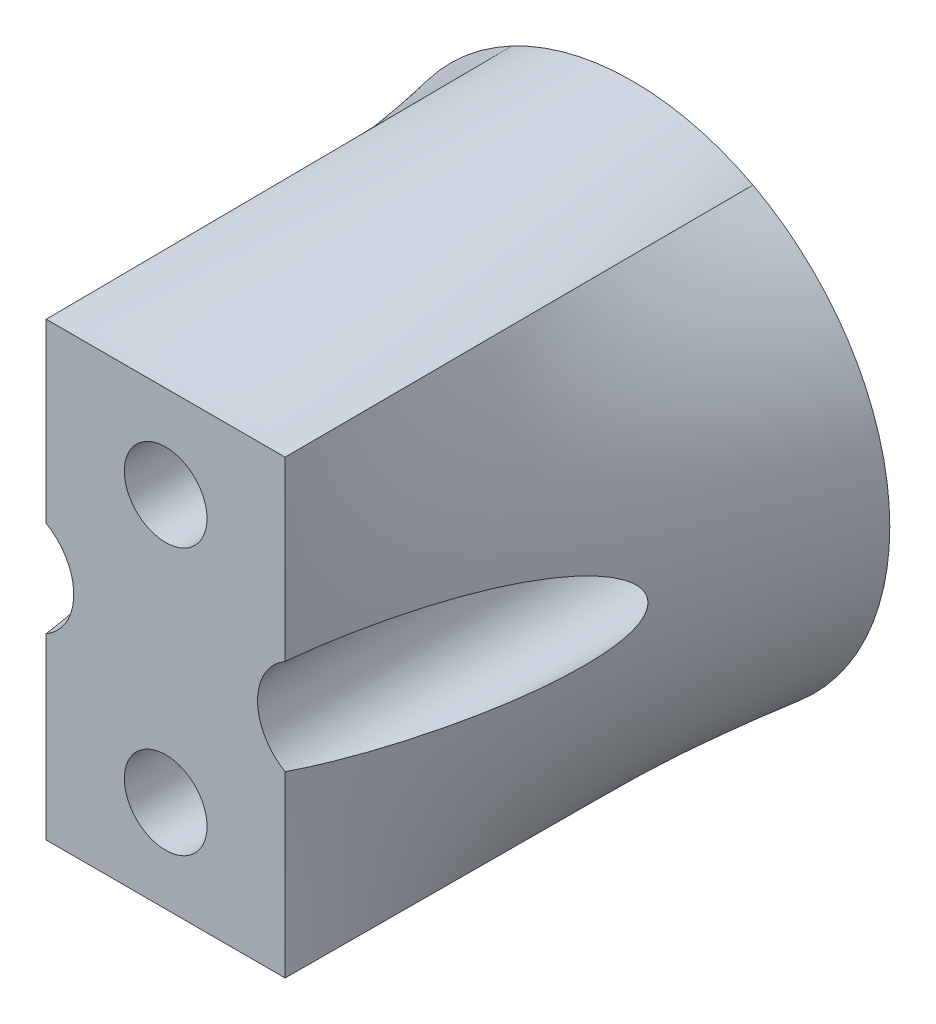
from build123d import *

# Parameters (mm, degrees)
CUT_EXTRUDE1_DEPTH      = 0.254
CUT_EXTRUDE1_DEPTH_BACK = 29.404968727
CUT_EXTRUDE1_START      = -3.8
SKETCH5_R               = 2.999999969
SKETCH5_R_2             = 3
SKETCH6_R               = 1.75
CUT_EXTRUDE2_DEPTH      = 33.204968727
SKETCH7_R               = 2.25
SKETCH7_R_2             = 2.249999945
CUT_EXTRUDE3_DEPTH      = 33.204968727
SKETCH8_R               = 3.8
CUT_EXTRUDE4_DEPTH      = 19.05
SKETCH9_R               = 4.5
CUT_EXTRUDE5_DEPTH      = 3.5


with BuildPart() as part:
    # Loft1: read off the stored shape, not the designer's step
    # Loft1: loft between two sections, ruled curve by curve
    loft1_from = [
        Edge.make_bspline([(6.55325358, -12.371534566, 0), (7.464294458, -11.888952404, 0), (8.384566214, -11.272101526, 0), (10.134710604, -9.728764793, 0), (10.963640628, -8.800972824, 0), (12.385245025, -6.653137916, 0), (12.975801321, -5.432751611, 0), (13.784177023, -2.807609973, 0), (14, -1.404493643, 0), (14, 1.404493643, 0), (13.784177023, 2.807609973, 0), (12.975801321, 5.432751611, 0), (12.385245025, 6.653137916, 0), (10.963640628, 8.800972824, 0), (10.134710604, 9.728764793, 0), (8.384566214, 11.272101526, 0), (7.464294458, 11.888952404, 0), (6.55325358, 12.371534566, 0)], [0, 0, 0, 0, 0.125, 0.125, 0.25, 0.25, 0.375, 0.375, 0.5, 0.5, 0.625, 0.625, 0.75, 0.75, 0.875, 0.875, 1, 1, 1, 1], 3),
        Edge.make_bspline([(6.55325358, 12.371534566, 0), (5.588089256, 12.882786143, 0), (4.533369794, 13.294840206, 0), (2.318771517, 13.853790689, 0), (1.159653791, 14, 0), (-1.159653791, 14, 0), (-2.318771517, 13.853790689, 0), (-4.533369794, 13.294840206, 0), (-5.588089256, 12.882786143, 0), (-6.55325358, 12.371534566, 0)], [0, 0, 0, 0, 0.25, 0.25, 0.5, 0.5, 0.75, 0.75, 1, 1, 1, 1], 3),
        Edge.make_bspline([(-6.55325358, -12.371534566, 0), (-5.588089256, -12.882786143, 0), (-4.533369794, -13.294840206, 0), (-2.318771517, -13.853790689, 0), (-1.159653791, -14, 0), (1.159653791, -14, 0), (2.318771517, -13.853790689, 0), (4.533369794, -13.294840206, 0), (5.588089256, -12.882786143, 0), (6.55325358, -12.371534566, 0)], [0, 0, 0, 0, 0.25, 0.25, 0.5, 0.5, 0.75, 0.75, 1, 1, 1, 1], 3),
        Edge.make_bspline([(-6.55325358, 12.371534566, 0), (-7.464294458, 11.888952404, 0), (-8.384566214, 11.272101526, 0), (-10.134710604, 9.728764793, 0), (-10.963640628, 8.800972824, 0), (-12.385245025, 6.653137916, 0), (-12.975801321, 5.432751611, 0), (-13.784177023, 2.807609973, 0), (-14, 1.404493643, 0), (-14, -1.404493643, 0), (-13.784177023, -2.807609973, 0), (-12.975801321, -5.432751611, 0), (-12.385245025, -6.653137916, 0), (-10.963640628, -8.800972824, 0), (-10.134710604, -9.728764793, 0), (-8.384566214, -11.272101526, 0), (-7.464294458, -11.888952404, 0), (-6.55325358, -12.371534566, 0)], [0, 0, 0, 0, 0.125, 0.125, 0.25, 0.25, 0.375, 0.375, 0.5, 0.5, 0.625, 0.625, 0.75, 0.75, 0.875, 0.875, 1, 1, 1, 1], 3),
    ]
    loft1_to = [
        Edge.make_bspline([(6.5, -12.319, 25.4), (6.5, -11.296416667, 25.4), (6.5, -10.273833333, 25.4), (6.5, -8.228666667, 25.4), (6.5, -7.206083333, 25.4), (6.5, -5.160916667, 25.4), (6.5, -4.138333333, 25.4), (6.5, -2.093166667, 25.4), (6.5, -1.070583333, 25.4), (6.5, 0.974583333, 25.4), (6.5, 1.997166667, 25.4), (6.5, 4.042333333, 25.4), (6.5, 5.064916667, 25.4), (6.5, 7.110083333, 25.4), (6.5, 8.132666667, 25.4), (6.5, 10.177833333, 25.4), (6.5, 11.200416667, 25.4), (6.5, 12.223, 25.4)], [0, 0, 0, 0, 0.125, 0.125, 0.25, 0.25, 0.375, 0.375, 0.5, 0.5, 0.625, 0.625, 0.75, 0.75, 0.875, 0.875, 1, 1, 1, 1], 3),
        Edge.make_bspline([(6.5, 12.223, 25.4), (5.416666667, 12.223, 25.4), (4.333333333, 12.223, 25.4), (2.166666667, 12.223, 25.4), (1.083333333, 12.223, 25.4), (-1.083333333, 12.223, 25.4), (-2.166666667, 12.223, 25.4), (-4.333333333, 12.223, 25.4), (-5.416666667, 12.223, 25.4), (-6.5, 12.223, 25.4)], [0, 0, 0, 0, 0.25, 0.25, 0.5, 0.5, 0.75, 0.75, 1, 1, 1, 1], 3),
        Edge.make_bspline([(-6.5, -12.319, 25.4), (-5.416666667, -12.319, 25.4), (-4.333333333, -12.319, 25.4), (-2.166666667, -12.319, 25.4), (-1.083333333, -12.319, 25.4), (1.083333333, -12.319, 25.4), (2.166666667, -12.319, 25.4), (4.333333333, -12.319, 25.4), (5.416666667, -12.319, 25.4), (6.5, -12.319, 25.4)], [0, 0, 0, 0, 0.25, 0.25, 0.5, 0.5, 0.75, 0.75, 1, 1, 1, 1], 3),
        Edge.make_bspline([(-6.5, 12.223, 25.4), (-6.5, 11.200416667, 25.4), (-6.5, 10.177833333, 25.4), (-6.5, 8.132666667, 25.4), (-6.5, 7.110083333, 25.4), (-6.5, 5.064916667, 25.4), (-6.5, 4.042333333, 25.4), (-6.5, 1.997166667, 25.4), (-6.5, 0.974583333, 25.4), (-6.5, -1.070583333, 25.4), (-6.5, -2.093166667, 25.4), (-6.5, -4.138333333, 25.4), (-6.5, -5.160916667, 25.4), (-6.5, -7.206083333, 25.4), (-6.5, -8.228666667, 25.4), (-6.5, -10.273833333, 25.4), (-6.5, -11.296416667, 25.4), (-6.5, -12.319, 25.4)], [0, 0, 0, 0, 0.125, 0.125, 0.25, 0.25, 0.375, 0.375, 0.5, 0.5, 0.625, 0.625, 0.75, 0.75, 0.875, 0.875, 1, 1, 1, 1], 3),
    ]
    loft1 = Solid(Shell([*[Face.make_surface_from_curves(loft1_from[k], loft1_to[k]) for k in range(4)], Face(Wire(loft1_from)), Face(Wire(loft1_to))]))
    add(loft1)

    # Sketch5 → Cut-Extrude1 (cut, two sides: drawn at the far end of the back side and taken through both)
    with BuildSketch(Plane(origin=(0, 0, 0), x_dir=(-1, 0, 0), z_dir=(0, 0, -1)).offset(CUT_EXTRUDE1_START - CUT_EXTRUDE1_DEPTH_BACK)):
        with Locations(Location((-8, 0, 0), (0, 0, 300.000000342))):
            Circle(SKETCH5_R)
        with Locations(Location((8, 0, 0), (0, 0, 240))):
            Circle(SKETCH5_R_2)
    extrude(amount=CUT_EXTRUDE1_DEPTH + CUT_EXTRUDE1_DEPTH_BACK, mode=Mode.SUBTRACT)

    # Sketch6 → Cut-Extrude2 (cut, through all)
    with BuildSketch(Plane(origin=(0, 0, 0), x_dir=(-1, 0, 0), z_dir=(0, 0, -1))):
        with Locations((-8, 0)):
            Circle(SKETCH6_R)
        with Locations((8, 0)):
            Circle(SKETCH6_R)
    extrude(amount=-CUT_EXTRUDE2_DEPTH, mode=Mode.SUBTRACT)

    # Sketch7 → Cut-Extrude3 (cut, through all)
    with BuildSketch(Plane.XY.offset(25.4)):
        with Locations((0, -7.298)):
            Circle(SKETCH7_R)
        with Locations((0, 7.202)):
            Circle(SKETCH7_R_2)
    extrude(amount=-CUT_EXTRUDE3_DEPTH, mode=Mode.SUBTRACT)

    # Sketch8 → Cut-Extrude4 (cut)
    with BuildSketch(Plane(origin=(0, 0, 0), x_dir=(-1, 0, 0), z_dir=(0, 0, -1))):
        with Locations((0, -7.298)):
            Circle(SKETCH8_R)
        with Locations((0, 7.202)):
            Circle(SKETCH8_R)
    extrude(amount=-CUT_EXTRUDE4_DEPTH, mode=Mode.SUBTRACT)

    # Sketch9 → Cut-Extrude5 (cut)
    with BuildSketch(Plane(origin=(0, 0, 0), x_dir=(-1, 0, 0), z_dir=(0, 0, -1))):
        Circle(SKETCH9_R)
    extrude(amount=-CUT_EXTRUDE5_DEPTH, mode=Mode.SUBTRACT)


solid = part.part
